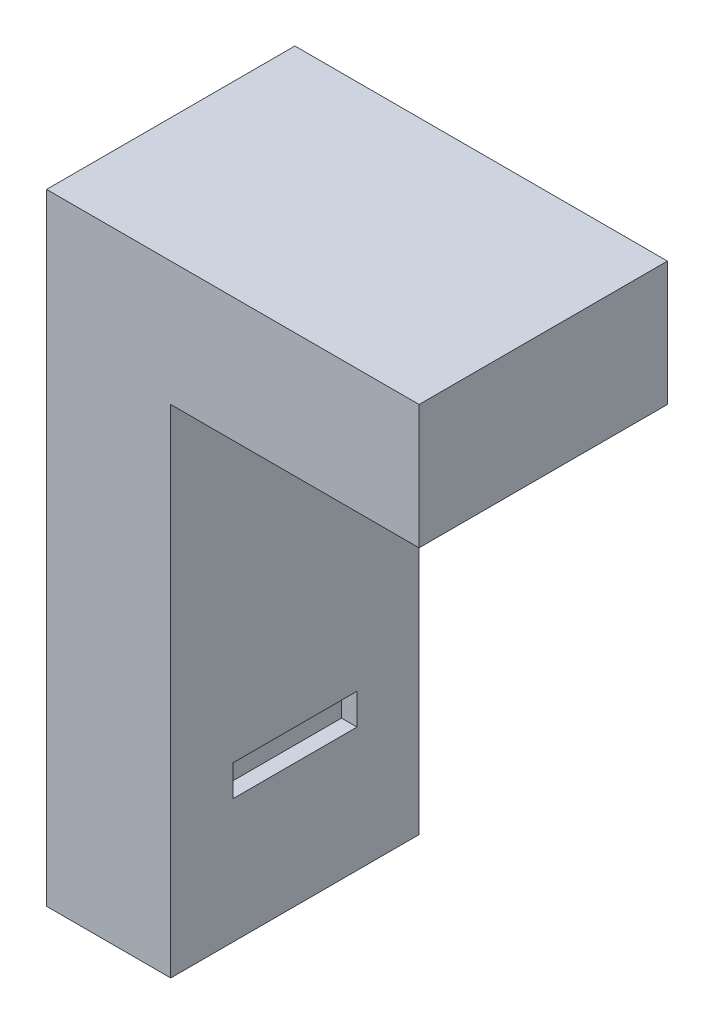
from build123d import *

# Parameters (mm, degrees)
BOSS_EXTRUDE1_DEPTH = 25.4
SKETCH2_W           = 12.7
SKETCH2_H           = 3.175
CUT_EXTRUDE1_DEPTH  = 1.5875


with BuildPart() as part:
    # Sketch1 → Boss-Extrude1 (new body)
    with BuildSketch(Plane.XY):
        Polygon((-12.7, 0), (-12.7, 63.5), (25.4, 63.5), (25.4, 50.8), (0, 50.8), (0, 0), align=None)
    extrude(amount=-BOSS_EXTRUDE1_DEPTH)

    # Sketch2 → Cut-Extrude1 (cut)
    with BuildSketch(Plane(origin=(0, 0, 0), x_dir=(0, 0, -1), z_dir=(1, 0, 0))):
        with Locations((12.7, 14.2875)):
            Rectangle(SKETCH2_W, SKETCH2_H)
    extrude(amount=-CUT_EXTRUDE1_DEPTH, mode=Mode.SUBTRACT)


solid = part.part
